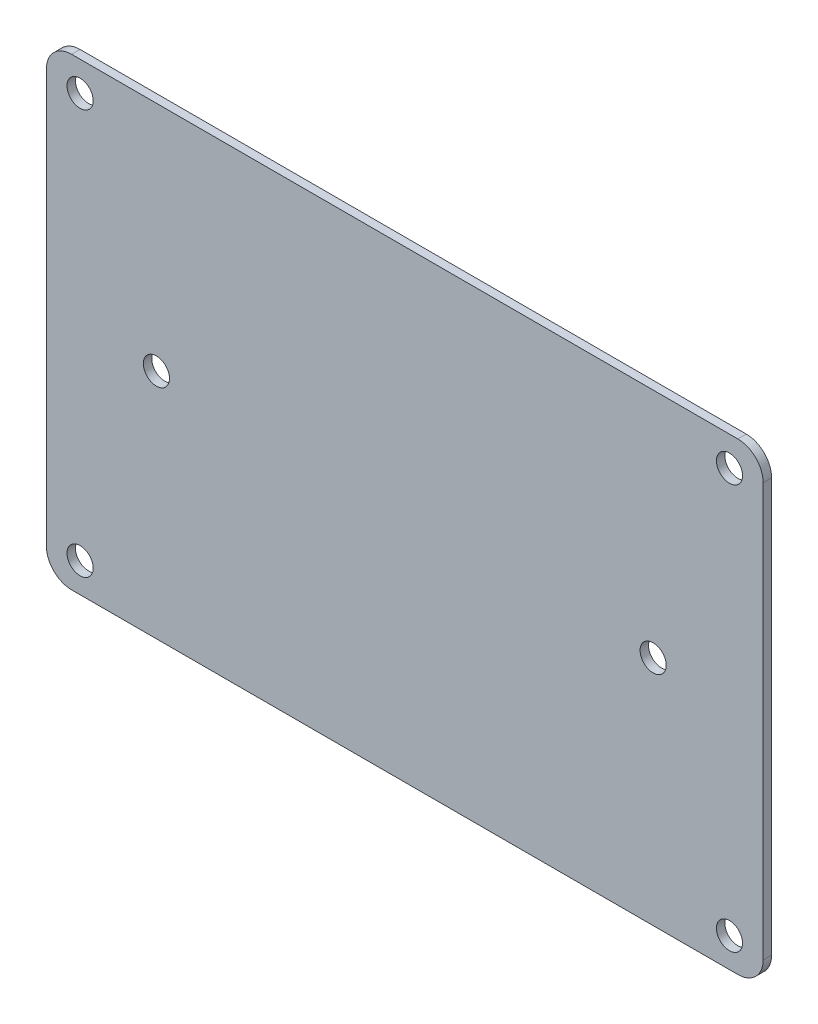
from build123d import *

# Parameters (mm, degrees)
SKETCH1_R           = 1.55
BOSS_EXTRUDE1_DEPTH = 1
CUT_EXTRUDE7_REACH  = 52.631
SKETCH3_R           = 1.55
SKETCH4_R           = 1.55
CUT_EXTRUDE8_DEPTH  = 51.631018161
SKETCH7_R           = 1.55
CUT_EXTRUDE9_DEPTH  = 51.631018161
CUT_EXTRUDE10_REACH = 52.631
SKETCH8_R           = 1.55


with BuildPart() as part:
    # Sketch1 → Boss-Extrude1 (new body)
    with BuildSketch(Plane.XY):
        with BuildLine():
            Line((-39.5, 27.5), (39.5, 27.5))
            ThreePointArc((39.5, 27.5), (41.621320344, 26.621320344), (42.5, 24.5))
            Line((42.5, 24.5), (42.5, -24.5))
            ThreePointArc((42.5, -24.5), (41.621320344, -26.621320344), (39.5, -27.5))
            Line((39.5, -27.5), (-39.5, -27.5))
            ThreePointArc((-39.5, -27.5), (-41.621320344, -26.621320344), (-42.5, -24.5))
            Line((-42.5, -24.5), (-42.5, 24.5))
            ThreePointArc((-42.5, 24.5), (-41.621320344, 26.621320344), (-39.5, 27.5))
        make_face()
        with Locations((-38.5, -24)):
            Circle(SKETCH1_R, mode=Mode.SUBTRACT)
    extrude(amount=BOSS_EXTRUDE1_DEPTH)

    # Sketch3 → Cut-Extrude7 (cut, up to next)
    with BuildSketch(Plane.XY, mode=Mode.PRIVATE) as cut_extrude7_sk1:
        with Locations((38.5, -24)):
            Circle(SKETCH3_R)
    cut_extrude7_tool1 = extrude(cut_extrude7_sk1.sketch, amount=CUT_EXTRUDE7_REACH, mode=Mode.PRIVATE) & part.part
    add(cut_extrude7_tool1.solids().sort_by_distance((38.5, -24, 0))[0], mode=Mode.SUBTRACT)

    # Sketch4 → Cut-Extrude8 (cut, through all)
    with BuildSketch(Plane.XY.offset(1)):
        with Locations((-38.5, 24)):
            Circle(SKETCH4_R)
    extrude(amount=-CUT_EXTRUDE8_DEPTH, mode=Mode.SUBTRACT)

    # Sketch7 → Cut-Extrude9 (cut, through all)
    with BuildSketch(Plane.XY.offset(1)):
        with Locations((38.5, 24)):
            Circle(SKETCH7_R)
    extrude(amount=-CUT_EXTRUDE9_DEPTH, mode=Mode.SUBTRACT)

    # Sketch8 → Cut-Extrude10 (cut, up to next)
    with BuildSketch(Plane(origin=(0, 0, 0), x_dir=(-1, 0, 0), z_dir=(0, 0, -1)), mode=Mode.PRIVATE) as cut_extrude10_sk1:
        with Locations((-29.45, 0)):
            Circle(SKETCH8_R)
    cut_extrude10_tool1 = extrude(cut_extrude10_sk1.sketch, amount=-CUT_EXTRUDE10_REACH, mode=Mode.PRIVATE) & part.part
    # Sketch8 → Cut-Extrude10 (cut, up to next)
    with BuildSketch(Plane(origin=(0, 0, 0), x_dir=(-1, 0, 0), z_dir=(0, 0, -1)), mode=Mode.PRIVATE) as cut_extrude10_sk2:
        with Locations((29.45, 0)):
            Circle(SKETCH8_R)
    cut_extrude10_tool2 = extrude(cut_extrude10_sk2.sketch, amount=-CUT_EXTRUDE10_REACH, mode=Mode.PRIVATE) & part.part
    add(cut_extrude10_tool1.solids().sort_by_distance((29.45, 0, 0))[0], mode=Mode.SUBTRACT)
    add(cut_extrude10_tool2.solids().sort_by_distance((-29.45, 0, 0))[0], mode=Mode.SUBTRACT)


solid = part.part
